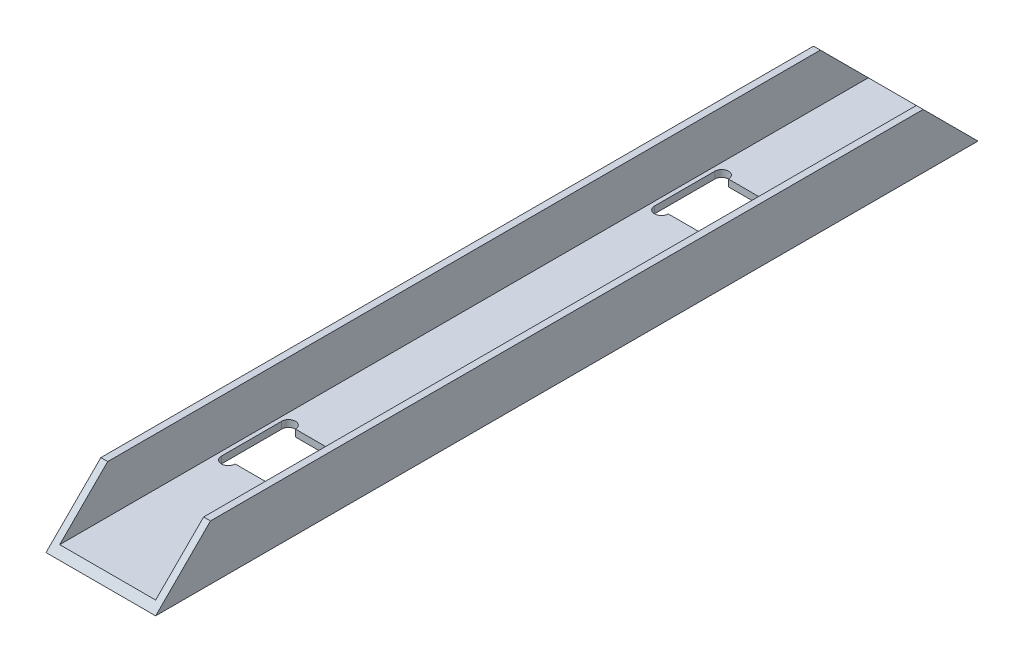
from build123d import *

# Parameters (mm, degrees)
BOSS_EXTRUDE1_DEPTH = 381
CUT_EXTRUDE1_DEPTH  = 386.210072558
CUT_EXTRUDE3_DEPTH  = 383.689587002


with BuildPart() as part:
    # Sketch1 → Boss-Extrude1 (new body)
    with BuildSketch(Plane.XY):
        Polygon((-25.4, 0), (25.4, 0), (25.4, 25.4), (22.225, 25.4), (22.225, 3.175), (-22.225, 3.175), (-22.225, 25.4), (-25.4, 25.4), align=None)
    extrude(amount=BOSS_EXTRUDE1_DEPTH)

    # Sketch2 → Cut-Extrude1 (cut, through all)
    with BuildSketch(Plane(origin=(25.4, 0, 0), x_dir=(0, 0, -1), z_dir=(1, 0, 0))):
        Polygon((-381, 0), (-355.6, 25.4), (-381, 25.4), align=None)
        Polygon((0, 0), (0, 25.4), (-25.4, 25.4), align=None)
    extrude(amount=-CUT_EXTRUDE1_DEPTH, mode=Mode.SUBTRACT)

    # Sketch4 → Cut-Extrude3 (cut, through all)
    with BuildSketch(Plane.XZ):
        with BuildLine():
            Line((-13.97, 276.86), (13.97, 276.86))
            ThreePointArc((13.97, 276.86), (17.145, 273.685), (20.32, 276.86))
            Line((20.32, 276.86), (20.32, 304.8))
            ThreePointArc((20.32, 304.8), (17.145, 307.975), (13.97, 304.8))
            Line((13.97, 304.8), (-13.97, 304.8))
            ThreePointArc((-13.97, 304.8), (-17.145, 307.975), (-20.32, 304.8))
            Line((-20.32, 304.8), (-20.32, 276.86))
            ThreePointArc((-20.32, 276.86), (-17.145, 273.685), (-13.97, 276.86))
        make_face()
        with BuildLine():
            Line((-20.32, 104.14), (-20.32, 76.2))
            ThreePointArc((-20.32, 76.2), (-17.145, 73.025), (-13.97, 76.2))
            Line((-13.97, 76.2), (13.97, 76.2))
            ThreePointArc((13.97, 76.2), (17.145, 73.025), (20.32, 76.2))
            Line((20.32, 76.2), (20.32, 104.14))
            ThreePointArc((20.32, 104.14), (17.145, 107.315), (13.97, 104.14))
            Line((13.97, 104.14), (-13.97, 104.14))
            ThreePointArc((-13.97, 104.14), (-17.145, 107.315), (-20.32, 104.14))
        make_face()
    extrude(amount=-CUT_EXTRUDE3_DEPTH, mode=Mode.SUBTRACT)


solid = part.part
